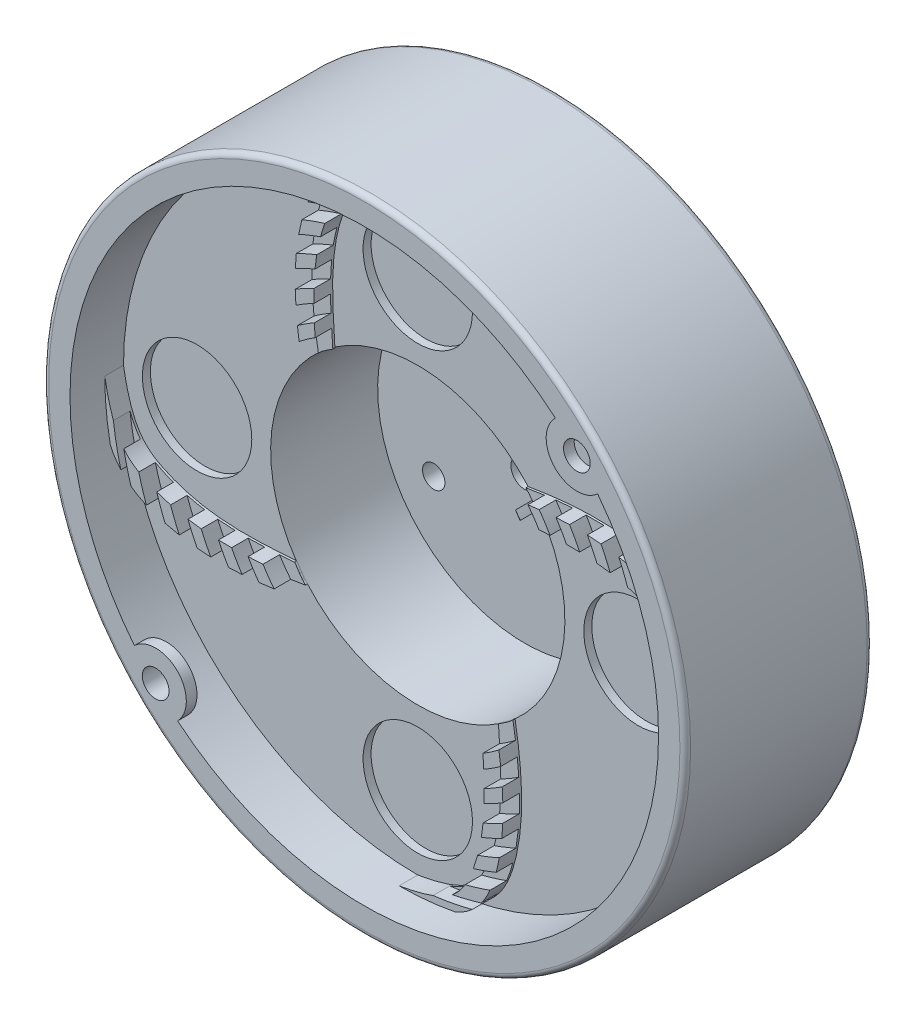
from build123d import *

# Parameters (mm, degrees)
ESQUISSE1_R              = 60
BOSS_EXTRU_1_DEPTH       = 35
COQUE1_T                 = -5
ESQUISSE3_R              = 2.6
ENL_V_MAT_EXTRU_1_DEPTH  = 20
EMPREINTE1_OUTLINE_R     = 4.6614
EMPREINTE1_OUTLINE_R_2   = 2.6
EMPREINTE1_DEPTH         = 1.53
ESQUISSE4_R              = 2.1
ENL_V_MAT_EXTRU_2_DEPTH  = 10
ESQUISSE5_R              = 55.619471738
ESQUISSE5_R_2            = 27.5
BOSS_EXTRU_3_DEPTH       = 20
CONG_3_R                 = 1
CONG_4_R                 = 1
ESQUISSE7_R              = 10.224638807
ENL_V_MAT_EXTRU_4_DEPTH  = 1.5
BOSS_EXTRU_4_DEPTH       = 3.5
ESQUISSE9_R              = 30.183608374
ESQUISSE9_R_2            = 27.121069805
ENL_V_MAT_EXTRU_6_DEPTH  = 3.1
ESQUISSE10_R             = 35.107417703
ESQUISSE10_R_2           = 32.350074377
ENL_V_MAT_EXTRU_8_DEPTH  = 3.1
ESQUISSE11_R             = 45.157672746
ESQUISSE11_R_2           = 42.346203804
ESQUISSE11_R_3           = 40.174511002
ESQUISSE11_R_4           = 37.303588829
ENL_V_MAT_EXTRU_9_DEPTH  = 3.1
ESQUISSE12_R             = 53.764456788
ESQUISSE12_R_2           = 52.402010896
ESQUISSE12_R_3           = 50.183911415
ESQUISSE12_R_4           = 47.357118392
ENL_V_MAT_EXTRU_10_DEPTH = 3.1
ESQUISSE13_R             = 2.5
BOSS_EXTRU_5_DEPTH       = 2
ESQUISSE15_R             = 2.5
ENL_V_MAT_EXTRU_11_DEPTH = 4


# Read off the part's stored shape, not the designer's step: Empreinte1
with BuildPart() as part:
    # Esquisse1 → Boss.-Extru.1 (new body)
    with BuildSketch(Plane.XY):
        Circle(ESQUISSE1_R)
    extrude(amount=BOSS_EXTRU_1_DEPTH)

    # Coque1
    coque1_openings = [part.faces().sort_by_distance(p)[0] for p in [
        (0, 0, 35),
    ]]
    offset(amount=COQUE1_T, openings=coque1_openings, kind=Kind.INTERSECTION)

    # Esquisse3 → Enlèv. mat.-Extru.1 (cut)
    with BuildSketch(Plane.XY.offset(5)):
        Circle(ESQUISSE3_R)
    extrude(amount=-ENL_V_MAT_EXTRU_1_DEPTH, mode=Mode.SUBTRACT)

    # Empreinte1 outline → Empreinte1 (cut)
    with BuildSketch(Plane.XY):
        Circle(EMPREINTE1_OUTLINE_R)
        Circle(EMPREINTE1_OUTLINE_R_2, mode=Mode.SUBTRACT)
    extrude(amount=EMPREINTE1_DEPTH, mode=Mode.SUBTRACT)

    # Esquisse4 → Enlèv. mat.-Extru.2 (cut)
    with BuildSketch(Plane(origin=(0, 0, 0), x_dir=(-1, 0, 0), z_dir=(0, 0, -1))):
        with Locations((17.016506367, -8.982678389)):
            Circle(ESQUISSE4_R)
        with Locations((-17.926802475, -6.991405653)):
            Circle(ESQUISSE4_R)
    extrude(amount=-ENL_V_MAT_EXTRU_2_DEPTH, mode=Mode.SUBTRACT)

    # Esquisse5 → Boss.-Extru.3 (add)
    with BuildSketch(Plane.XY.offset(5)):
        Circle(ESQUISSE5_R)
        Circle(ESQUISSE5_R_2, mode=Mode.SUBTRACT)
    extrude(amount=BOSS_EXTRU_3_DEPTH)

    # Congé3
    cong_3_edges = [part.edges().sort_by_distance(p)[0] for p in [
        (-60, 0, 0),
    ]]
    fillet(cong_3_edges, radius=CONG_3_R)

    # Congé4
    cong_4_edges = [part.edges().sort_by_distance(p)[0] for p in [
        (-60, 0, 35),
    ]]
    fillet(cong_4_edges, radius=CONG_4_R)

    # Esquisse7 → Enlèv. mat.-Extru.4 (cut)
    with BuildSketch(Plane.XY.offset(25)):
        with Locations((41.25, 0)):
            Circle(ESQUISSE7_R)
        with Locations((0, -41.25)):
            Circle(ESQUISSE7_R)
        with Locations((-41.25, 0)):
            Circle(ESQUISSE7_R)
        with Locations((0, 41.25)):
            Circle(ESQUISSE7_R)
    extrude(amount=-ENL_V_MAT_EXTRU_4_DEPTH, mode=Mode.SUBTRACT)

    # Esquisse8 → Boss.-Extru.4 (add)
    with BuildSketch(Plane.XY.offset(25)):
        with BuildLine():
            Line((22.720979346, 15.492162456), (22.606617018, 15.458219447))
            Line((22.606617018, 15.458219447), (22.097471982, 16.219339323))
            Line((22.097471982, 16.219339323), (21.673254788, 16.853500741))
            Line((21.673254788, 16.853500741), (21.237786441, 17.470158187))
            Line((21.237786441, 17.470158187), (21.059826271, 17.684278821))
            Line((21.059826271, 17.684278821), (20.673944023, 18.074081955))
            Line((20.673944023, 18.074081955), (20.600240559, 18.148534309))
            Line((20.600240559, 18.148534309), (20.628335889, 18.185757022))
            add(Edge.make_bspline(
                [(20.628335889, 18.185757022), (28.081145498, 19.464030474), (38.769955818, 20.365185986), (50.619523048, 15.906880681), (55.115204536, 9.497523307), (54.753859154, 4.666441496), (56.153920377, 0.2176801), (55, 0)],
                knots=[0, 0, 0, 0, 0.47783181, 0.668612626, 0.766215383, 0.942992886, 1, 1, 1, 1], degree=3))
            add(Edge.make_bspline(
                [(55, 0), (53.443375116, 9.082592513), (48.738886922, 13.083026371), (36.089841622, 16.747759244), (25.92461623, 15.648235085), (22.720979346, 15.492162456)],
                knots=[0, 0, 0, 0, 0.286616358, 0.533504868, 1, 1, 1, 1], degree=3))
        make_face()
        with BuildLine():
            Line((15.492162456, -22.720979346), (15.458219447, -22.606617018))
            Line((15.458219447, -22.606617018), (16.219339323, -22.097471982))
            Line((16.219339323, -22.097471982), (16.853500741, -21.673254788))
            Line((16.853500741, -21.673254788), (17.470158187, -21.237786441))
            Line((17.470158187, -21.237786441), (17.684278821, -21.059826271))
            Line((17.684278821, -21.059826271), (18.074081955, -20.673944023))
            Line((18.074081955, -20.673944023), (18.148534309, -20.600240559))
            Line((18.148534309, -20.600240559), (18.185757022, -20.628335889))
            add(Edge.make_bspline(
                [(18.185757022, -20.628335889), (19.464030474, -28.081145498), (20.365185986, -38.769955818), (15.906880681, -50.619523048), (9.497523307, -55.115204536), (4.666441496, -54.753859154), (0.2176801, -56.153920377), (0, -55)],
                knots=[0, 0, 0, 0, 0.47783181, 0.668612626, 0.766215383, 0.942992886, 1, 1, 1, 1], degree=3))
            add(Edge.make_bspline(
                [(0, -55), (9.082592513, -53.443375116), (13.083026371, -48.738886922), (16.747759244, -36.089841622), (15.648235085, -25.92461623), (15.492162456, -22.720979346)],
                knots=[0, 0, 0, 0, 0.286616358, 0.533504868, 1, 1, 1, 1], degree=3))
        make_face()
        with BuildLine():
            Line((-22.720979346, -15.492162456), (-22.606617018, -15.458219447))
            Line((-22.606617018, -15.458219447), (-22.097471982, -16.219339323))
            Line((-22.097471982, -16.219339323), (-21.673254788, -16.853500741))
            Line((-21.673254788, -16.853500741), (-21.237786441, -17.470158187))
            Line((-21.237786441, -17.470158187), (-21.059826271, -17.684278821))
            Line((-21.059826271, -17.684278821), (-20.673944023, -18.074081955))
            Line((-20.673944023, -18.074081955), (-20.600240559, -18.148534309))
            Line((-20.600240559, -18.148534309), (-20.628335889, -18.185757022))
            add(Edge.make_bspline(
                [(-20.628335889, -18.185757022), (-28.081145498, -19.464030474), (-38.769955818, -20.365185986), (-50.619523048, -15.906880681), (-55.115204536, -9.497523307), (-54.753859154, -4.666441496), (-56.153920377, -0.2176801), (-55, 0)],
                knots=[0, 0, 0, 0, 0.47783181, 0.668612626, 0.766215383, 0.942992886, 1, 1, 1, 1], degree=3))
            add(Edge.make_bspline(
                [(-55, 0), (-53.443375116, -9.082592513), (-48.738886922, -13.083026371), (-36.089841622, -16.747759244), (-25.92461623, -15.648235085), (-22.720979346, -15.492162456)],
                knots=[0, 0, 0, 0, 0.286616358, 0.533504868, 1, 1, 1, 1], degree=3))
        make_face()
        with BuildLine():
            Line((-15.492162456, 22.720979346), (-15.458219447, 22.606617018))
            Line((-15.458219447, 22.606617018), (-16.219339323, 22.097471982))
            Line((-16.219339323, 22.097471982), (-16.853500741, 21.673254788))
            Line((-16.853500741, 21.673254788), (-17.470158187, 21.237786441))
            Line((-17.470158187, 21.237786441), (-17.684278821, 21.059826271))
            Line((-17.684278821, 21.059826271), (-18.074081955, 20.673944023))
            Line((-18.074081955, 20.673944023), (-18.148534309, 20.600240559))
            Line((-18.148534309, 20.600240559), (-18.185757022, 20.628335889))
            add(Edge.make_bspline(
                [(-18.185757022, 20.628335889), (-19.464030474, 28.081145498), (-20.365185986, 38.769955818), (-15.906880681, 50.619523048), (-9.497523307, 55.115204536), (-4.666441496, 54.753859154), (-0.2176801, 56.153920377), (0, 55)],
                knots=[0, 0, 0, 0, 0.47783181, 0.668612626, 0.766215383, 0.942992886, 1, 1, 1, 1], degree=3))
            add(Edge.make_bspline(
                [(0, 55), (-9.082592513, 53.443375116), (-13.083026371, 48.738886922), (-16.747759244, 36.089841622), (-15.648235085, 25.92461623), (-15.492162456, 22.720979346)],
                knots=[0, 0, 0, 0, 0.286616358, 0.533504868, 1, 1, 1, 1], degree=3))
        make_face()
    extrude(amount=BOSS_EXTRU_4_DEPTH)

    # Esquisse9 → Enlèv. mat.-Extru.6 (cut)
    with BuildSketch(Plane.XY.offset(28.5)):
        with Locations((0.23161418, 0.228097653)):
            Circle(ESQUISSE9_R)
        with Locations((0.23161418, 0.228097653)):
            Circle(ESQUISSE9_R_2, mode=Mode.SUBTRACT)
    extrude(amount=-ENL_V_MAT_EXTRU_6_DEPTH, mode=Mode.SUBTRACT)

    # Esquisse10 → Enlèv. mat.-Extru.8 (cut)
    with BuildSketch(Plane.XY.offset(28.5)):
        Circle(ESQUISSE10_R)
        Circle(ESQUISSE10_R_2, mode=Mode.SUBTRACT)
    extrude(amount=-ENL_V_MAT_EXTRU_8_DEPTH, mode=Mode.SUBTRACT)

    # Esquisse11 → Enlèv. mat.-Extru.9 (cut)
    # profile 1 of 2: a face of its own
    with BuildSketch(Plane.XY.offset(28.5)):
        Circle(ESQUISSE11_R)
        Circle(ESQUISSE11_R_2, mode=Mode.SUBTRACT)
    # profile 2 of 2: a face of its own
    with BuildSketch(Plane.XY.offset(28.5)):
        Circle(ESQUISSE11_R_3)
        Circle(ESQUISSE11_R_4, mode=Mode.SUBTRACT)
    extrude(amount=-ENL_V_MAT_EXTRU_9_DEPTH, mode=Mode.SUBTRACT)

    # Esquisse12 → Enlèv. mat.-Extru.10 (cut)
    # profile 1 of 2: a face of its own
    with BuildSketch(Plane.XY.offset(28.5)):
        Circle(ESQUISSE12_R)
        Circle(ESQUISSE12_R_2, mode=Mode.SUBTRACT)
    # profile 2 of 2: a face of its own
    with BuildSketch(Plane.XY.offset(28.5)):
        Circle(ESQUISSE12_R_3)
        Circle(ESQUISSE12_R_4, mode=Mode.SUBTRACT)
    extrude(amount=-ENL_V_MAT_EXTRU_10_DEPTH, mode=Mode.SUBTRACT)

    # Esquisse13 → Boss.-Extru.5 (add)
    # profile 1 of 2: a face of its own
    with BuildSketch(Plane.XY.offset(35)):
        with BuildLine():
            Line((-42.960790682, -34.341963601), (-45.905927968, -37.062727603))
            Line((-45.905927968, -37.062727603), (-37.742787129, -45.254658116))
            Line((-37.742787129, -45.254658116), (-34.899166388, -42.50938938))
            ThreePointArc((-34.899166388, -42.50938938), (-34.91113237, -34.458890779), (-42.960790682, -34.341963601))
        make_face()
        with Locations((-38.995368755, -38.490219639)):
            Circle(ESQUISSE13_R, mode=Mode.SUBTRACT)
    # profile 2 of 2: a face of its own
    with BuildSketch(Plane.XY.offset(35)):
        with BuildLine():
            Line((38.534899535, 44.677304281), (46.457236633, 36.252272009))
            Line((46.457236633, 36.252272009), (43.621012269, 33.49936251))
            ThreePointArc((43.621012269, 33.49936251), (35.575154181, 33.772928834), (35.719868111, 41.822135552))
            Line((35.719868111, 41.822135552), (38.534899535, 44.677304281))
        make_face()
        with Locations((39.737074154, 37.724007341)):
            Circle(ESQUISSE13_R, mode=Mode.SUBTRACT)
    extrude(amount=-BOSS_EXTRU_5_DEPTH)

    # Esquisse15 → Enlèv. mat.-Extru.11 (cut)
    with BuildSketch(Plane.XY.offset(35)):
        with Locations((39.737074154, 37.724007341)):
            Circle(ESQUISSE15_R)
        with Locations(Location((-38.995368755, -38.490219639, 0), (0, 0, 311.149647201))):
            Circle(ESQUISSE15_R)
    extrude(amount=-ENL_V_MAT_EXTRU_11_DEPTH, mode=Mode.SUBTRACT)


solid = part.part
